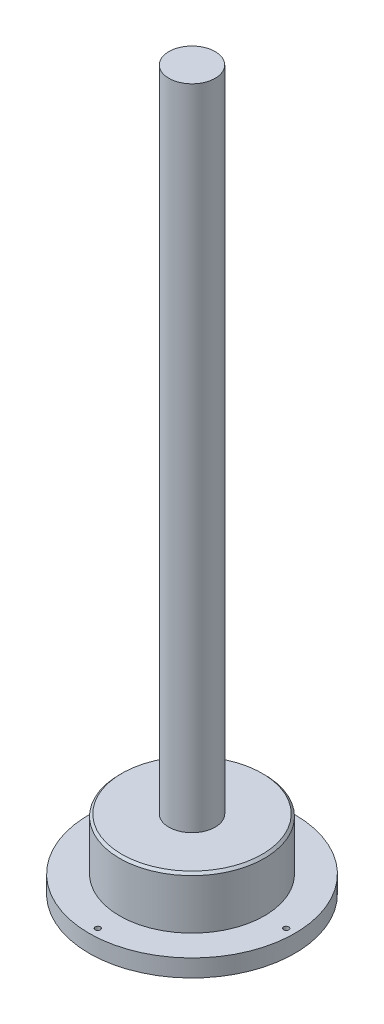
from build123d import *

# Parameters (mm, degrees)
SKETCH1_R                 = 39.749984
BOSS_EXTRUDE1_DEPTH       = 28.575
SKETCH2_R                 = 12.7
BOSS_EXTRUDE2_DEPTH       = 355.6
SKETCH3_R                 = 56.388
BOSS_EXTRUDE3_DEPTH       = 9.525
CHAMFER1_SIZE             = 1.27
TAP_DRILL_FOR_4_40_TAP1_D = 2.8702


with BuildPart() as part:
    # Sketch1 → Boss-Extrude1 (new body)
    with BuildSketch(Plane(origin=(0, 0, 0), x_dir=(1, 0, 0), z_dir=(0, 1, 0))):
        Circle(SKETCH1_R)
    extrude(amount=BOSS_EXTRUDE1_DEPTH)

    # Sketch2 → Boss-Extrude2 (add)
    with BuildSketch(Plane(origin=(0, 28.575, 0), x_dir=(1, 0, 0), z_dir=(0, 1, 0))):
        Circle(SKETCH2_R)
    extrude(amount=BOSS_EXTRUDE2_DEPTH)

    # Sketch3 → Boss-Extrude3 (add)
    with BuildSketch(Plane.XZ):
        Circle(SKETCH3_R)
    extrude(amount=BOSS_EXTRUDE3_DEPTH)

    # Chamfer1
    chamfer1_edges = [part.edges().sort_by_distance(p)[0] for p in [
        (-39.749984, 28.575, 0),
    ]]
    chamfer(chamfer1_edges, length=CHAMFER1_SIZE)

    # Tap Drill for #4-40 Tap1 (through all)
    with Locations(Plane(origin=(0, 0, 0), x_dir=(1, 0, 0), z_dir=(0, 1, 0))):
        with Locations((0, 51.6255), (51.6255, 0), (0, -51.6255), (-51.6255, 0)):
            Hole(TAP_DRILL_FOR_4_40_TAP1_D / 2)


solid = part.part
